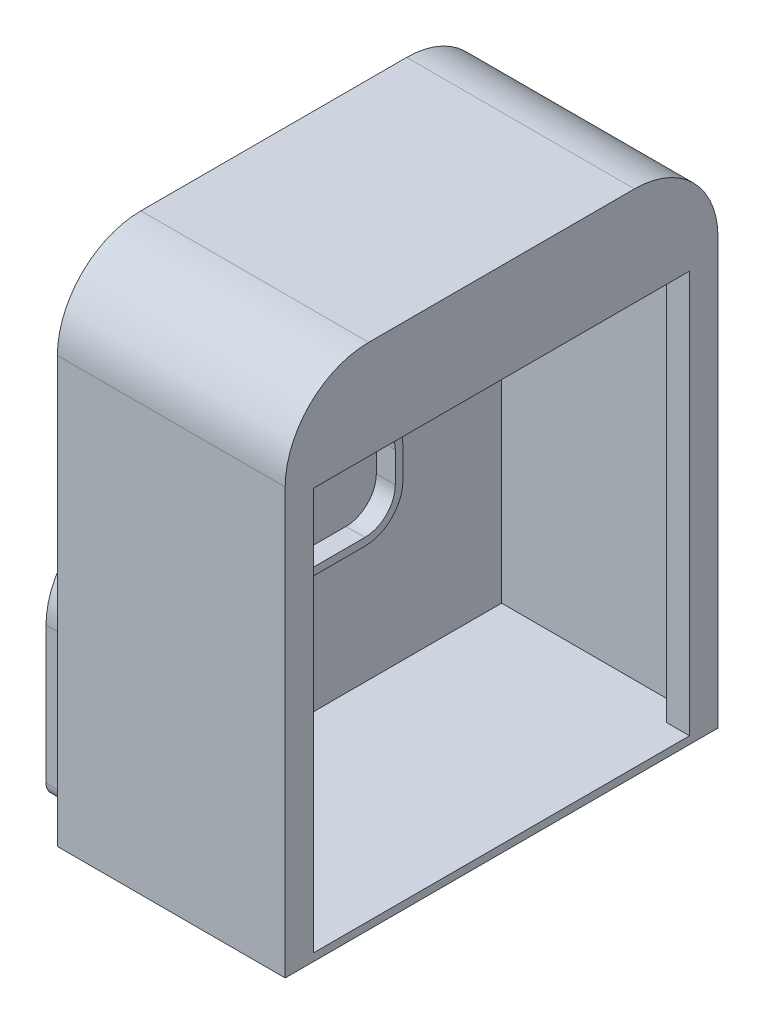
from build123d import *

# Parameters (mm, degrees)
EXTRUDE_THIN1_DEPTH = 5
BOSS_EXTRUDE1_DEPTH = 2.5
EXTRUDE_THIN2_DEPTH = 30
BOSS_EXTRUDE4_START = -3
BOSS_EXTRUDE4_DEPTH = 3
BOSS_EXTRUDE3_DEPTH = 5


with BuildPart() as part:
    # Sketch2 → Extrude-Thin1 (new body)
    with BuildSketch(Plane(origin=(0, 0, 0), x_dir=(0, 0, -1), z_dir=(1, 0, 0))):
        with BuildLine():
            Line((-12, 2), (-12, -2))
            ThreePointArc((-12, -2), (-10.535533906, -5.535533906), (-7, -7))
            Line((-7, -7), (7, -7))
            ThreePointArc((7, -7), (10.535533906, -5.535533906), (12, -2))
            Line((12, -2), (12, 2))
            ThreePointArc((12, 2), (10.535533906, 5.535533906), (7, 7))
            Line((7, 7), (-7, 7))
            ThreePointArc((-7, 7), (-10.535533906, 5.535533906), (-12, 2))
        make_face()
        with BuildLine():
            Line((-11, 2), (-11, -2))
            ThreePointArc((-11, -2), (-9.828427125, -4.828427125), (-7, -6))
            Line((-7, -6), (7, -6))
            ThreePointArc((7, -6), (9.828427125, -4.828427125), (11, -2))
            Line((11, -2), (11, 2))
            ThreePointArc((11, 2), (9.828427125, 4.828427125), (7, 6))
            Line((7, 6), (-7, 6))
            ThreePointArc((-7, 6), (-9.828427125, 4.828427125), (-11, 2))
        make_face(mode=Mode.SUBTRACT)
    extrude(amount=EXTRUDE_THIN1_DEPTH)

    # Sketch3 → Boss-Extrude1 (add)
    with BuildSketch(Plane(origin=(0, 0, 0), x_dir=(0, 0, -1), z_dir=(1, 0, 0))):
        with BuildLine():
            Line((27.5, -25), (-27.5, -25))
            Line((-27.5, -25), (-27.5, 30))
            ThreePointArc((-27.5, 30), (-24.571067812, 37.071067812), (-17.5, 40))
            Line((-17.5, 40), (17.5, 40))
            ThreePointArc((17.5, 40), (24.571067812, 37.071067812), (27.5, 30))
            Line((27.5, 30), (27.5, -25))
        make_face()
    extrude(amount=BOSS_EXTRUDE1_DEPTH)

    # Sketch3<2> → Extrude-Thin2 (add)
    with BuildSketch(Plane(origin=(0, 0, 0), x_dir=(0, 0, -1), z_dir=(1, 0, 0))):
        with BuildLine():
            Line((-17.5, 41), (17.5, 41))
            ThreePointArc((17.5, 41), (25.278174593, 37.778174593), (28.5, 30))
            Line((28.5, 30), (28.5, -26))
            Line((28.5, -26), (-28.5, -26))
            Line((-28.5, -26), (-28.5, 30))
            ThreePointArc((-28.5, 30), (-25.278174593, 37.778174593), (-17.5, 41))
        make_face()
        with BuildLine():
            Line((-17.5, 40), (17.5, 40))
            ThreePointArc((17.5, 40), (24.571067812, 37.071067812), (27.5, 30))
            Line((27.5, 30), (27.5, -25))
            Line((27.5, -25), (-27.5, -25))
            Line((-27.5, -25), (-27.5, 30))
            ThreePointArc((-27.5, 30), (-24.571067812, 37.071067812), (-17.5, 40))
        make_face(mode=Mode.SUBTRACT)
    extrude(amount=EXTRUDE_THIN2_DEPTH)

    # Sketch9 → Boss-Extrude4 (add)
    with BuildSketch(Plane(origin=(30, 0, 0), x_dir=(0, 0, -1), z_dir=(1, 0, 0)).offset(BOSS_EXTRUDE4_START)):
        with BuildLine():
            Line((27.5, -25), (27.5, 30))
            ThreePointArc((27.5, 30), (24.571067812, 37.071067812), (17.5, 40))
            Line((17.5, 40), (-17.5, 40))
            ThreePointArc((-17.5, 40), (-24.571067812, 37.071067812), (-27.5, 30))
            Line((-27.5, 30), (-27.5, -25))
            Line((-27.5, -25), (-24.75, -25))
            Line((-24.75, -25), (-24.75, 28))
            Line((-24.75, 28), (24.75, 28))
            Line((24.75, 28), (24.75, -25))
            Line((24.75, -25), (27.5, -25))
        make_face()
    extrude(amount=BOSS_EXTRUDE4_DEPTH)

    # Sketch8 → Boss-Extrude3 (add)
    with BuildSketch(Plane.ZY):
        with BuildLine():
            Line((-23, -25), (23, -25))
            ThreePointArc((23, -25), (24.414213562, -24.414213562), (25, -23))
            Line((25, -23), (25, -5))
            ThreePointArc((25, -5), (22.071067812, 2.071067812), (15, 5))
            Line((15, 5), (-15, 5))
            ThreePointArc((-15, 5), (-22.071067812, 2.071067812), (-25, -5))
            Line((-25, -5), (-25, -23))
            ThreePointArc((-25, -23), (-24.414213562, -24.414213562), (-23, -25))
        make_face()
    extrude(amount=BOSS_EXTRUDE3_DEPTH)


solid = part.part
